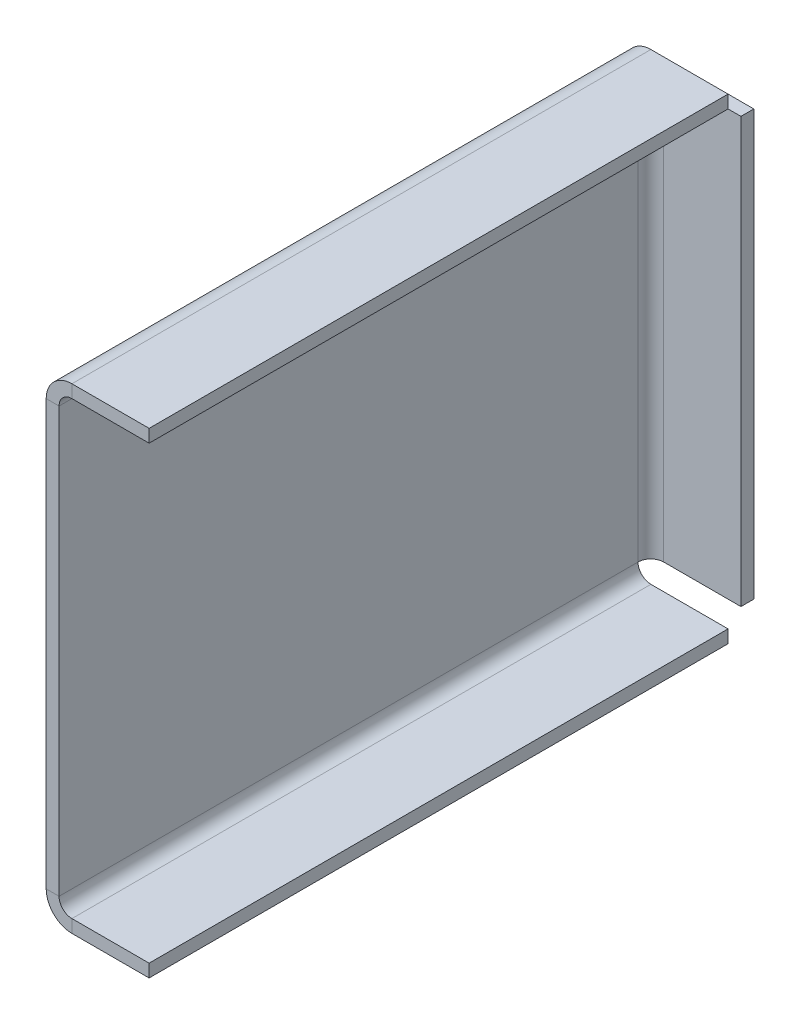
from build123d import *

# Parameters (mm, degrees)
BASE_FLANGE1_DEPTH = 142.875
EDGE_FLANGE1_DEPTH = 104.775


# Sheet-metal steps are written as plain solids
with BuildPart() as part:
    # Sketch1 → Base-Flange1 (new body)
    with BuildSketch(Plane.XY):
        with BuildLine():
            Line((25.4, 117.475), (6.35, 117.475))
            ThreePointArc((6.35, 117.475), (1.859871939, 115.615128061), (0, 111.125))
            Line((0, 111.125), (0, 6.35))
            ThreePointArc((0, 6.35), (1.859871939, 1.859871939), (6.35, 0))
            Line((6.35, 0), (25.4, 0))
            Line((25.4, 0), (25.4, 3.175))
            Line((25.4, 3.175), (6.35, 3.175))
            ThreePointArc((6.35, 3.175), (4.10493597, 4.10493597), (3.175, 6.35))
            Line((3.175, 6.35), (3.175, 111.125))
            ThreePointArc((3.175, 111.125), (4.10493597, 113.37006403), (6.35, 114.3))
            Line((6.35, 114.3), (25.4, 114.3))
            Line((25.4, 114.3), (25.4, 117.475))
        make_face()
    extrude(amount=BASE_FLANGE1_DEPTH)

    # Edge-Flange1 section (across the edge) → Edge-Flange1 (add)
    with BuildSketch(Plane(origin=(3.175, 6.35, -3.175), x_dir=(0, 0, 1), z_dir=(0, 1, 0))):
        with BuildLine():
            Line((-3.175, 3.175), (-3.175, 22.225))
            Line((-3.175, 22.225), (0, 22.225))
            Line((0, 22.225), (0, 3.175))
            ThreePointArc((0, 3.175), (0.92993597, 0.92993597), (3.175, 0))
            Line((3.175, 0), (3.175, -3.175))
            ThreePointArc((3.175, -3.175), (-1.315128061, -1.315128061), (-3.175, 3.175))
        make_face()
    extrude(amount=EDGE_FLANGE1_DEPTH)


solid = part.part
